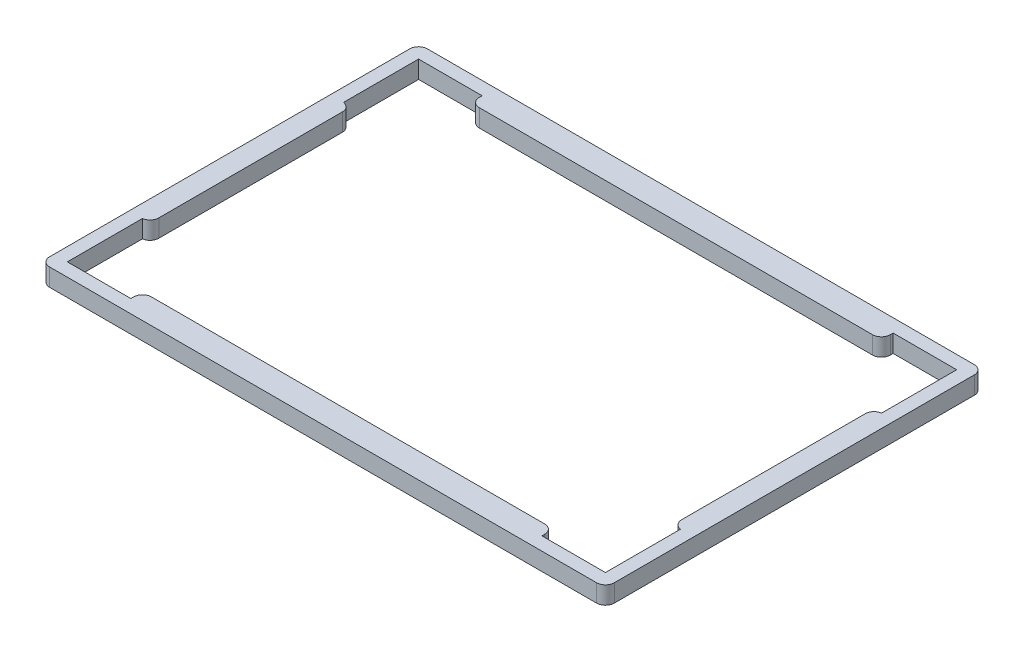
from build123d import *

# Parameters (mm, degrees)
SKETCH2_W           = 127.76
SKETCH2_H           = 85.48
SKETCH2_W_2         = 121.76
SKETCH2_H_2         = 79.48
SKETCH2_W_3         = 1.73
SKETCH2_H_3         = 45.5
SKETCH2_W_4         = 93
SKETCH2_H_4         = 2.65
BOSS_EXTRUDE1_DEPTH = 4
FILLET1_R           = 2


with BuildPart() as part:
    # Sketch2 → Boss-Extrude1 (new body)
    # profile 1 of 5: a face of its own
    with BuildSketch(Plane(origin=(0, 0, 0), x_dir=(1, 0, 0), z_dir=(0, 1, 0))):
        Rectangle(SKETCH2_W, SKETCH2_H)
        Rectangle(SKETCH2_W_2, SKETCH2_H_2, mode=Mode.SUBTRACT)
    # profile 2 of 5: a face of its own
    with BuildSketch(Plane(origin=(0, 0, 0), x_dir=(1, 0, 0), z_dir=(0, 1, 0))):
        with Locations((-60.015, 0)):
            Rectangle(SKETCH2_W_3, SKETCH2_H_3)
    # profile 3 of 5: a face of its own
    with BuildSketch(Plane(origin=(0, 0, 0), x_dir=(1, 0, 0), z_dir=(0, 1, 0))):
        with Locations((0, 38.415)):
            Rectangle(SKETCH2_W_4, SKETCH2_H_4)
    # profile 4 of 5: a face of its own
    with BuildSketch(Plane(origin=(0, 0, 0), x_dir=(1, 0, 0), z_dir=(0, 1, 0))):
        with Locations((60.015, 0)):
            Rectangle(SKETCH2_W_3, SKETCH2_H_3)
    # profile 5 of 5: a face of its own
    with BuildSketch(Plane(origin=(0, 0, 0), x_dir=(1, 0, 0), z_dir=(0, 1, 0))):
        with Locations((0, -38.415)):
            Rectangle(SKETCH2_W_4, SKETCH2_H_4)
    extrude(amount=BOSS_EXTRUDE1_DEPTH)

    # Fillet1
    # the kernel refuses this fillet: 2 mm, written as the material it takes off along each edge
    with BuildSketch(Plane(origin=(46.5, -5, 37.09), x_dir=(0, 0, 1), z_dir=(0, 1, 0)), Plane(origin=(-46.5, -5, 37.09), x_dir=(1, 0, 0), z_dir=(0, 1, 0)), Plane(origin=(-63.88, -5, 42.74), x_dir=(0, 0, -1), z_dir=(0, 1, 0)), Plane(origin=(63.88, -5, 42.74), x_dir=(-1, 0, 0), z_dir=(0, 1, 0))) as fillet1_piece_1:
        with BuildLine():
            CenterArc((FILLET1_R, -FILLET1_R), FILLET1_R, 90, 90)
            Line((0, -FILLET1_R), (-FILLET1_R * 0.02, -FILLET1_R))
            Line((-FILLET1_R * 0.02, -FILLET1_R), (-FILLET1_R * 0.02, FILLET1_R * 0.02))
            Line((-FILLET1_R * 0.02, FILLET1_R * 0.02), (FILLET1_R, FILLET1_R * 0.02))
            Line((FILLET1_R, FILLET1_R * 0.02), (FILLET1_R, 0))
        make_face()
    extrude(amount=14, mode=Mode.SUBTRACT)
    with BuildSketch(Plane(origin=(59.15, -4.954227992, 22.75), x_dir=(1, 0, 0), z_dir=(0, 1, 0)), Plane(origin=(-59.15, -4.954227992, -22.75), x_dir=(-1, 0, 0), z_dir=(0, 1, 0))) as fillet1_piece_2:
        with BuildLine():
            CenterArc((2, 1.981691197), FILLET1_R, 180, 82.241380111)
            Line((0, 1.981691197), (-0.04, 1.981691197))
            Line((-0.04, 1.981691197), (-0.04, 0))
            Line((-0.04, 0), (0, -0.04))
            ThreePointArc((0, -0.04), (0.865, -0.04), (1.7246, -0.039633824))
            Line((1.7246, -0.039633824), (1.73, 0))
        make_face()
    extrude(amount=13.908455985, mode=Mode.SUBTRACT)
    with BuildSketch(Plane(origin=(59.15, -4.954227992, -22.75), x_dir=(0, 0, 1), z_dir=(0, 1, 0)), Plane(origin=(-59.15, -4.954227992, 22.75), x_dir=(0, 0, -1), z_dir=(0, 1, 0))) as fillet1_piece_3:
        with BuildLine():
            CenterArc((1.981691197, 2), FILLET1_R, 187.758619889, 82.241380111)
            Line((0, 1.73), (-0.039633824, 1.7246))
            ThreePointArc((-0.039633824, 1.7246), (-0.04, 0.865), (-0.04, 0))
            Line((-0.04, 0), (0, -0.04))
            Line((0, -0.04), (1.981691197, -0.04))
            Line((1.981691197, -0.04), (1.981691197, 0))
        make_face()
    extrude(amount=13.908455985, mode=Mode.SUBTRACT)
    with BuildSketch(Plane(origin=(46.5, -5, -37.09), x_dir=(0, 0, -1), z_dir=(0, 1, 0)), Plane(origin=(-46.5, -5, -37.09), x_dir=(1, 0, 0), z_dir=(0, 1, 0)), Plane(origin=(-63.88, -5, -42.74), x_dir=(0, 0, 1), z_dir=(0, 1, 0)), Plane(origin=(63.88, -5, -42.74), x_dir=(-1, 0, 0), z_dir=(0, 1, 0))) as fillet1_piece_4:
        with BuildLine():
            CenterArc((FILLET1_R, FILLET1_R), FILLET1_R, 180, 90)
            Line((0, FILLET1_R), (-FILLET1_R * 0.02, FILLET1_R))
            Line((-FILLET1_R * 0.02, FILLET1_R), (-FILLET1_R * 0.02, -FILLET1_R * 0.02))
            Line((-FILLET1_R * 0.02, -FILLET1_R * 0.02), (FILLET1_R, -FILLET1_R * 0.02))
            Line((FILLET1_R, -FILLET1_R * 0.02), (FILLET1_R, 0))
        make_face()
    extrude(amount=14, mode=Mode.SUBTRACT)


solid = part.part
